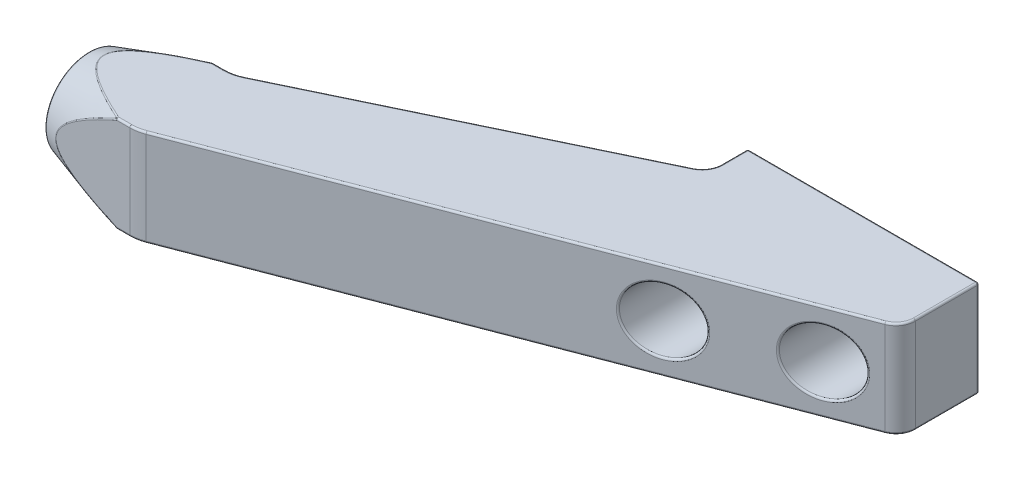
from build123d import *

# Parameters (mm, degrees)
BOSS_EXTRUDE1_DEPTH = 2.5
FILLET1_R           = 1
FILLET2_R           = 2
SKETCH2_R           = 0.875
CUT_EXTRUDE1_DEPTH  = 15
CUT_EXTRUDE2_START  = -2
SKETCH3_R           = 1.65
CUT_EXTRUDE2_DEPTH  = 15
SKETCH4_R           = 1
CUT_EXTRUDE3_DEPTH  = 4
FILLET3_R           = 0.1


with BuildPart() as part:
    # Sketch1 → Boss-Extrude1 (new, symmetric)
    with BuildSketch(Plane(origin=(0, 0, 0), x_dir=(1, 0, 0), z_dir=(0, 1, 0))):
        Polygon((-6, 0), (6, 0), (6, -4), (-22.7, -15), (-27.7, -15), (-27.7, -10), (-22.7, -10), (-6, -2), align=None)
    extrude(amount=BOSS_EXTRUDE1_DEPTH, both=True)

    # Fillet1
    fillet1_edges = [part.edges().sort_by_distance(p)[0] for p in [
        (-6, 0, 2),
        (6, 0, 4),
    ]]
    fillet(fillet1_edges, radius=FILLET1_R)

    # Fillet2
    fillet2_edges = [part.edges().sort_by_distance(p)[0] for p in [
        (-22.7, 0, 15),
        (-22.7, 0, 10),
    ]]
    fillet(fillet2_edges, radius=FILLET2_R)

    # Sketch2 → Cut-Extrude1 (cut)
    with BuildSketch(Plane(origin=(0, 0, 0), x_dir=(-1, 0, 0), z_dir=(0, 0, -1))):
        with Locations((-3, 0)):
            Circle(SKETCH2_R)
        with Locations((3, 0)):
            Circle(SKETCH2_R)
    extrude(amount=-CUT_EXTRUDE1_DEPTH, mode=Mode.SUBTRACT)

    # Sketch3 → Cut-Extrude2 (cut)
    with BuildSketch(Plane(origin=(0, 0, 0), x_dir=(-1, 0, 0), z_dir=(0, 0, -1)).offset(CUT_EXTRUDE2_START)):
        with Locations((3, 0)):
            Circle(SKETCH3_R)
        with Locations((-3, 0)):
            Circle(SKETCH3_R)
    extrude(amount=-CUT_EXTRUDE2_DEPTH, mode=Mode.SUBTRACT)

    # Sketch4 → Cut-Extrude3 (cut)
    with BuildSketch(Plane.ZY.offset(27.7)):
        with Locations((12.5, 0)):
            Circle(SKETCH4_R)
    extrude(amount=-CUT_EXTRUDE3_DEPTH, mode=Mode.SUBTRACT)

    # Sketch5 → Cut-Revolve1 (revolve, cut)
    with BuildSketch(Plane.XY.offset(12.5)):
        Polygon((-27.7, 2.25), (-27.7, 3.75), (-22.95, 3.75), align=None)
    revolve(axis=Axis((-27.7, 0, 12.5), (-1, 0, 0)), mode=Mode.SUBTRACT)

    # Fillet3
    fillet3_edges = [part.edges().sort_by_distance(p)[0] for p in [
        (4.65, -7.427e-06, 4.517421603),
        (-1.35, -7.427e-06, 6.817073171),
        (-8.498240513, -2.5, 9.556816921),
        (-8.498240513, 2.5, 9.556816921),
        (-27.7, -2.25, 12.5),
        (-27.7, 0, 11.5),
        (-26.908333328, -8.786e-05, 15),
        (-26.908333328, 8.786e-05, 10),
        (-25.536794814, 2.5, 10.965992881),
        (-23.7, 0, 11.5),
        (4.65, 0, 2),
        (-1.35, 0, 2),
        (3.875, 0, 2),
        (-2.125, 0, 2),
        (-2.125, 0, 0),
        (3.875, 0, 0),
        (-6, -2.5, 0.685111101),
        (-14.429118134, -2.5, 6.037900902),
        (-23.391732468, -2.5, 10),
        (-23.349644928, -2.5, 15),
        (6, -2.5, 1.656170562),
        (0, -2.5, 0),
        (-6, 2.5, 0.685111101),
        (-23.391732468, 2.5, 10),
        (-23.349644928, 2.5, 15),
        (6, 2.5, 1.656170562),
        (0, 2.5, 0),
        (-6, 0, 0),
        (6, 0, 0),
        (5.823980805, -2.5, 3.878958838),
        (5.823980805, 2.5, 3.878958838),
        (-6.153823695, -2.5, 1.903125252),
        (-6.153823695, 2.5, 1.903125252),
        (-22.706180851, -2.5, 14.966603285),
        (-22.706180851, 2.5, 14.966603285),
        (-22.711287018, -2.5, 9.950312727),
        (-22.711287018, 2.5, 9.950312727),
        (-26.908333328, -2.5, 12.50008786),
        (-14.429118134, 2.5, 6.037900902),
    ]]
    fillet(fillet3_edges, radius=FILLET3_R)


solid = part.part
